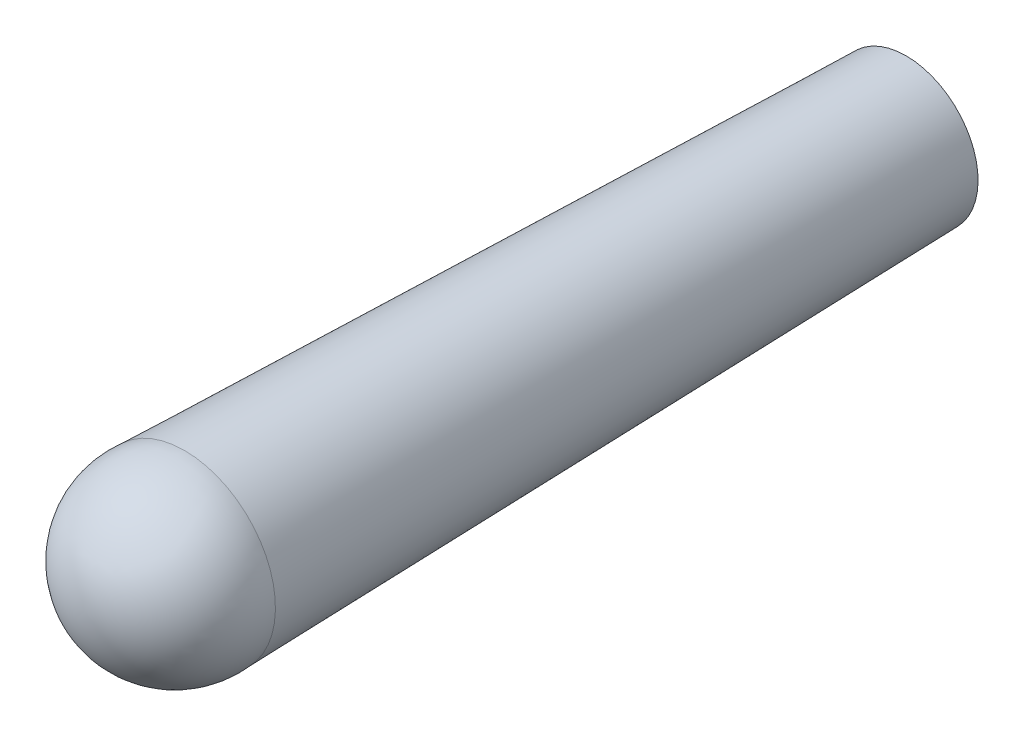
from build123d import *


# Read off the part's stored shape, not the designer's step: Surface-Imported1
with BuildPart() as part:
    # Sketch1 → Revolve1 (revolve)
    with BuildSketch(Plane(origin=(0, 0, 0), x_dir=(0, 0, -1), z_dir=(1, 0, 0))):
        with BuildLine():
            Line((-1.737704184, 0), (-15.707704184, 0))
            ThreePointArc((-15.707704184, 0), (-15.15655538, 1.235594348), (-13.868962067, 1.651))
            Line((-13.868962067, 1.651), (-0.748275349, 1.307422727))
            Line((-0.748275349, 1.307422727), (-1.737704184, 0))
        make_face()
    revolve(axis=Axis((0, 0, 1.737704184), (0, 0, 1)))


solid = part.part
